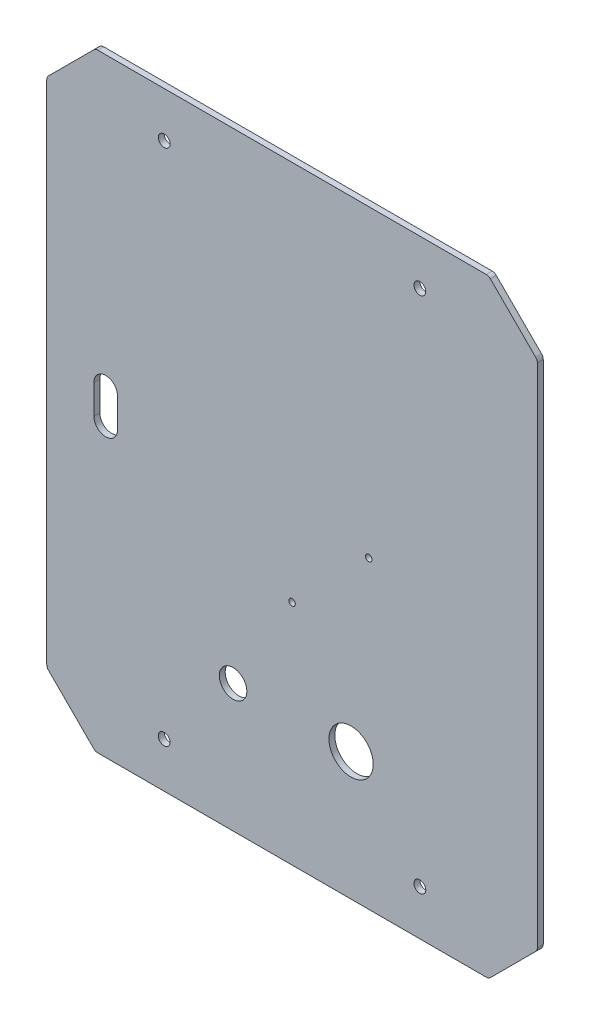
from build123d import *

# Parameters (mm, degrees)
BASE_DEPTH                     = 3
CONG_1_R                       = 3
ESQUISSE20_R                   = 3
PER_AGE_PROFIL_S_DEPTH         = 383.50448595
ESQUISSE21_R                   = 1.65
PER_AGE_LIDAR_DEPTH            = 383.50448595
ESQUISSE22_R                   = 11.25
PER_AGE_ARRET_D_URGENCE_DEPTH  = 383.50448595
ESQUISSE23_R                   = 7
PER_AGE_TIRETTE_DEPTH          = 383.50448595
PER_AGE_CABLE_MANAGEMENT_DEPTH = 383.50448595


with BuildPart() as part:
    # Esquisse1 → Base (new body)
    with BuildSketch(Plane.XY):
        Polygon((0, 0), (-200, 0), (-224.748737342, 24.748737342), (-224.748737342, 284.748737342), (-200, 309.497474683), (0, 309.497474683), (24.748737342, 284.748737342), (24.748737342, 24.748737342), align=None)
    extrude(amount=BASE_DEPTH)

    # Congé1
    cong_1_edges = [part.edges().sort_by_distance(p)[0] for p in [
        (-200, 0, 1.5),
        (-224.748737342, 24.748737342, 1.5),
        (-224.748737342, 284.748737342, 1.5),
        (-200, 309.497474683, 1.5),
        (0, 309.497474683, 1.5),
        (24.748737342, 284.748737342, 1.5),
        (24.748737342, 24.748737342, 1.5),
        (0, 0, 1.5),
    ]]
    fillet(cong_1_edges, radius=CONG_1_R)

    # Esquisse20 → Perçage Profilés (cut, through all)
    with BuildSketch(Plane(origin=(0, 0, 0), x_dir=(-1, 0, 0), z_dir=(0, 0, -1))):
        with Locations((35, 286.497474683)):
            Circle(ESQUISSE20_R)
        with Locations((165, 286.497474683)):
            Circle(ESQUISSE20_R)
        with Locations((165, 23)):
            Circle(ESQUISSE20_R)
        with Locations((35, 23)):
            Circle(ESQUISSE20_R)
    extrude(amount=-PER_AGE_PROFIL_S_DEPTH, mode=Mode.SUBTRACT)

    # Esquisse21 → Perçage Lidar (cut, through all)
    with BuildSketch(Plane(origin=(0, 0, 0), x_dir=(-1, 0, 0), z_dir=(0, 0, -1))):
        with Locations((61, 154.748737342)):
            Circle(ESQUISSE21_R)
        with Locations((100, 115.748737342)):
            Circle(ESQUISSE21_R)
    extrude(amount=-PER_AGE_LIDAR_DEPTH, mode=Mode.SUBTRACT)

    # Esquisse22 → Perçage Arret d'urgence (cut, through all)
    with BuildSketch(Plane(origin=(0, 0, 0), x_dir=(-1, 0, 0), z_dir=(0, 0, -1))):
        with Locations((70, 65)):
            Circle(ESQUISSE22_R)
    extrude(amount=-PER_AGE_ARRET_D_URGENCE_DEPTH, mode=Mode.SUBTRACT)

    # Esquisse23 → Perçage Tirette (cut, through all)
    with BuildSketch(Plane(origin=(0, 0, 0), x_dir=(-1, 0, 0), z_dir=(0, 0, -1))):
        with Locations((130, 65)):
            Circle(ESQUISSE23_R)
    extrude(amount=-PER_AGE_TIRETTE_DEPTH, mode=Mode.SUBTRACT)

    # Esquisse24 → Perçage Cable management (cut, through all)
    with BuildSketch(Plane(origin=(0, 0, 0), x_dir=(-1, 0, 0), z_dir=(0, 0, -1))):
        with BuildLine():
            Line((188.748737342, 147.248737342), (188.748737342, 162.248737342))
            ThreePointArc((188.748737342, 162.248737342), (194.748737342, 168.248737342), (200.748737342, 162.248737342))
            Line((200.748737342, 162.248737342), (200.748737342, 147.248737342))
            ThreePointArc((200.748737342, 147.248737342), (194.748737342, 141.248737342), (188.748737342, 147.248737342))
        make_face()
    extrude(amount=-PER_AGE_CABLE_MANAGEMENT_DEPTH, mode=Mode.SUBTRACT)


solid = part.part
